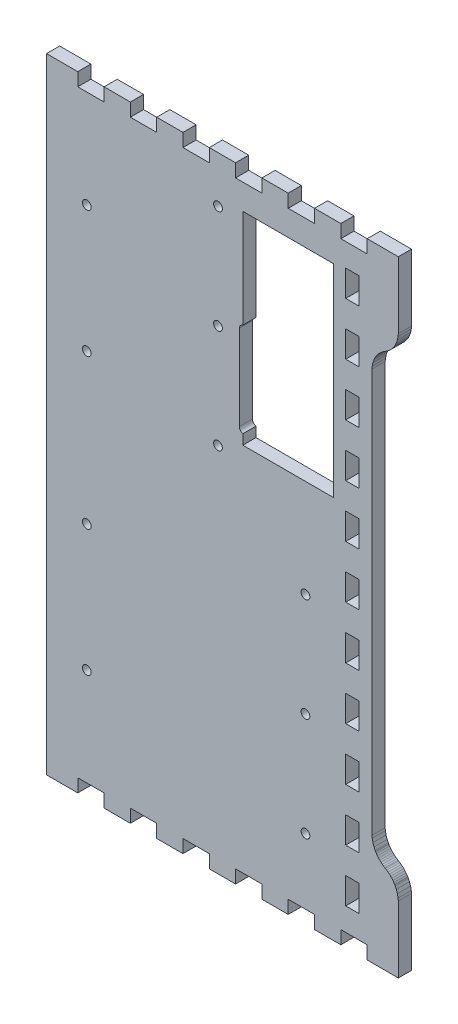
from build123d import *

# Parameters (mm, degrees)
BOSS_EXTRUDE1_DEPTH   = 5.715
CUT_EXTRUDE1_DEPTH    = 1564.565019976
F_6_CLEARANCE_HOLE1_D = 3.7973


with BuildPart() as part:
    # Model → Boss-Extrude1 (new body)
    with BuildSketch(Plane.XY):
        Polygon((1382.75, 22.8575), (1396.32, 22.8575), (1396.32, 28.5722), (1407.75, 28.5722), (1407.75, 22.8575), (1419.18, 22.8575), (1419.18, 28.5722), (1430.61, 28.5722), (1430.61, 22.8575), (1442.04, 22.8575), (1442.04, 28.5722), (1453.47, 28.5722), (1453.47, 22.8575), (1464.9, 22.8575), (1464.9, 28.5722), (1476.33, 28.5722), (1476.33, 22.8575), (1487.76, 22.8575), (1487.76, 28.5722), (1499.19, 28.5722), (1499.19, 22.8575), (1510.62, 22.8575), (1510.62, 28.5722), (1522.05, 28.5722), (1522.05, 22.8575), (1535.61, 22.8575), (1535.61, 28.5722), (1535.61, 51.4325), (1535.61, 51.8072), (1535.51, 52.9276), (1535.22, 54.3913), (1534.74, 55.8038), (1534.27, 56.8247), (1534.08, 57.1472), (1533.99, 57.3098), (1533.68, 57.7854), (1533.25, 58.3928), (1532.77, 58.9703), (1532.27, 59.5147), (1531.72, 60.0244), (1531.14, 60.4986), (1530.53, 60.9353), (1530.06, 61.2387), (1529.9, 61.3311), (1529.74, 61.4246), (1529.26, 61.728), (1528.65, 62.1647), (1528.07, 62.6389), (1527.53, 63.1486), (1527.02, 63.693), (1526.55, 64.2705), (1526.11, 64.878), (1525.81, 65.3535), (1525.71, 65.5147), (1525.53, 65.8386), (1525.05, 66.8595), (1524.57, 68.272), (1524.28, 69.7357), (1524.18, 70.8561), (1524.18, 71.2294), (1524.18, 245.915), (1524.18, 246.29), (1524.28, 247.41), (1524.57, 248.874), (1525.05, 250.286), (1525.53, 251.307), (1525.71, 251.63), (1525.81, 251.792), (1526.11, 252.268), (1526.55, 252.876), (1527.02, 253.453), (1527.53, 253.997), (1528.07, 254.507), (1528.65, 254.981), (1529.26, 255.418), (1529.74, 255.72), (1529.9, 255.814), (1530.06, 255.907), (1530.53, 256.211), (1531.14, 256.647), (1531.72, 257.121), (1532.27, 257.631), (1532.77, 258.175), (1533.25, 258.753), (1533.68, 259.36), (1533.99, 259.836), (1534.08, 259.997), (1534.27, 260.321), (1534.74, 261.342), (1535.22, 262.755), (1535.51, 264.218), (1535.61, 265.339), (1535.61, 265.712), (1535.61, 288.572), (1535.61, 294.287), (1522.05, 294.287), (1522.05, 288.572), (1510.62, 288.572), (1510.62, 294.287), (1499.19, 294.287), (1499.19, 288.572), (1487.76, 288.572), (1487.76, 294.287), (1476.33, 294.287), (1476.33, 288.572), (1464.9, 288.572), (1464.9, 294.287), (1453.47, 294.287), (1453.47, 288.572), (1442.04, 288.572), (1442.04, 294.287), (1430.61, 294.287), (1430.61, 288.572), (1419.18, 288.572), (1419.18, 294.287), (1407.75, 294.287), (1407.75, 288.572), (1396.32, 288.572), (1396.32, 294.287), (1382.75, 294.287), (1382.75, 288.572), (1382.75, 28.5722), align=None)
        Polygon((1518.47, 44.2722), (1518.47, 38.5576), (1512.75, 38.5576), (1512.75, 49.9868), (1518.47, 49.9868), align=None, mode=Mode.SUBTRACT)
        Polygon((1518.47, 67.1326), (1518.47, 61.4179), (1512.75, 61.4179), (1512.75, 72.8472), (1518.47, 72.8472), align=None, mode=Mode.SUBTRACT)
        Polygon((1518.47, 89.9929), (1518.47, 84.2779), (1512.75, 84.2779), (1512.75, 95.7076), (1518.47, 95.7076), align=None, mode=Mode.SUBTRACT)
        Polygon((1518.47, 112.853), (1518.47, 107.137), (1512.75, 107.137), (1512.75, 118.568), (1518.47, 118.568), align=None, mode=Mode.SUBTRACT)
        Polygon((1518.47, 135.712), (1518.47, 129.997), (1512.75, 129.997), (1512.75, 141.428), (1518.47, 141.428), align=None, mode=Mode.SUBTRACT)
        Polygon((1518.47, 158.572), (1518.47, 152.858), (1512.75, 152.858), (1512.75, 164.287), (1518.47, 164.287), align=None, mode=Mode.SUBTRACT)
        Polygon((1518.47, 181.433), (1518.47, 175.718), (1512.75, 175.718), (1512.75, 187.147), (1518.47, 187.147), align=None, mode=Mode.SUBTRACT)
        Polygon((1518.47, 204.293), (1518.47, 198.578), (1512.75, 198.578), (1512.75, 210.008), (1518.47, 210.008), align=None, mode=Mode.SUBTRACT)
        Polygon((1518.47, 227.153), (1518.47, 221.437), (1512.75, 221.437), (1512.75, 232.868), (1518.47, 232.868), align=None, mode=Mode.SUBTRACT)
        Polygon((1518.47, 250.012), (1518.47, 244.297), (1512.75, 244.297), (1512.75, 255.728), (1518.47, 255.728), align=None, mode=Mode.SUBTRACT)
        Polygon((1518.47, 272.872), (1518.47, 267.158), (1512.75, 267.158), (1512.75, 278.587), (1518.47, 278.587), align=None, mode=Mode.SUBTRACT)
    extrude(amount=BOSS_EXTRUDE1_DEPTH)

    # Sketch1 → Cut-Extrude1 (cut, through all)
    with BuildSketch(Plane(origin=(0, 0, 0), x_dir=(-1, 0, 0), z_dir=(0, 0, -1))):
        with BuildLine():
            Line((-1468.0398, 276.0723), (-1468.0398, 277.5723))
            Line((-1468.0398, 277.5723), (-1507.5398, 277.5723))
            Line((-1507.5398, 277.5723), (-1507.5398, 276.0723))
            Line((-1507.5398, 276.0723), (-1507.5398, 191.0723))
            Line((-1507.5398, 191.0723), (-1507.5398, 189.5723))
            Line((-1507.5398, 189.5723), (-1468.0398, 189.5723))
            Line((-1468.0398, 189.5723), (-1468.0398, 191.0723))
            Line((-1468.0398, 191.0723), (-1468.0398, 193.885808327))
            ThreePointArc((-1468.0398, 193.885808327), (-1466.95866117, 194.597555129), (-1466.5398, 195.8223))
            Line((-1466.5398, 195.8223), (-1466.5398, 232.8223))
            ThreePointArc((-1466.5398, 232.8223), (-1466.95866117, 234.047044871), (-1468.0398, 234.758791673))
            Line((-1468.0398, 234.758791673), (-1468.0398, 276.0723))
        make_face()
    extrude(amount=-CUT_EXTRUDE1_DEPTH, mode=Mode.SUBTRACT)

    # #6 Clearance Hole1 (through all)
    with Locations(Plane(origin=(0, 0, 0), x_dir=(-1, 0, 0), z_dir=(0, 0, -1))):
        with Locations((-1400.25, 246.0721), (-1400.25, 191.0721), (-1400.25, 126.0721), (-1400.25, 71.0721), (-1457.2548, 274.072), (-1457.2548, 229.072), (-1457.2548, 184.072), (-1495.2548, 147.02225), (-1495.2548, 102.02225), (-1495.2548, 57.02225)):
            Hole(F_6_CLEARANCE_HOLE1_D / 2)


solid = part.part
